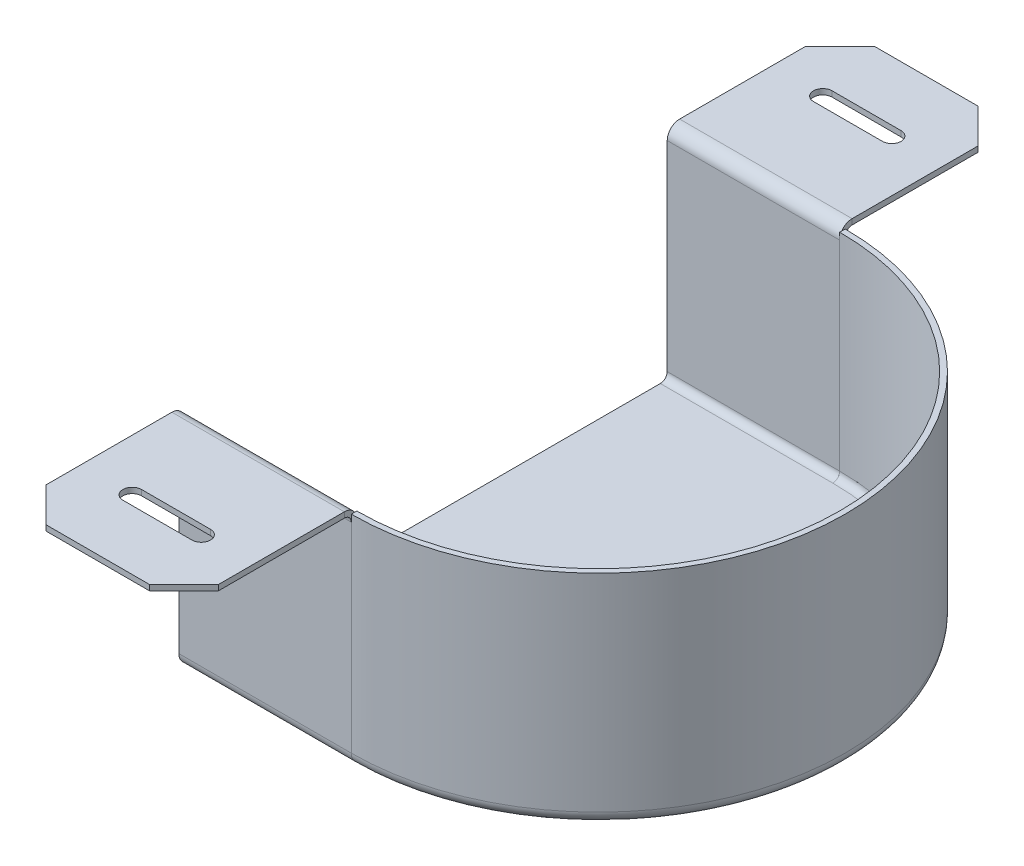
from build123d import *

# Parameters (mm, degrees)
SM_BASE_FLANGE_2_DEPTH             = 1.6
SM_START                           = -50
SM_EDGE_FLANGE_2_DEPTH             = 121.6
SM_EDGE_FLANGE_2_2_DEPTH           = 50
SM_EDGE_FLANGE_2_3_ANGLE           = 180
SM_EDGE_FLANGE_2_4_ANGLE           = 180
SM_EDGE_FLANGE_3_STRIP_W           = 10.4
SM_EDGE_FLANGE_3_STRIP_H           = 1.6
SM_EDGE_FLANGE_3_STRIP_CUT_DEPTH   = 50
SM_EDGE_FLANGE_3_STRIP_2_W         = 10.4
SM_EDGE_FLANGE_3_STRIP_2_H         = 1.6
SM_EDGE_FLANGE_3_STRIP_CUT_2_DEPTH = 50
SM_EDGE_FLANGE_3_DEPTH             = 50
SM_EDGE_FLANGE_3_BEND_DEPTH        = 50
CHAMFER_1_SIZE                     = 10
CUT_EXTRUDE_1_REACH                = 155.608


with BuildPart() as part:
    # 基材-凸緣2: sheet metal written as solids
    # 草圖6 → 基材-凸緣2 (new body)
    with BuildSketch(Plane(origin=(0, 0, 0), x_dir=(1, 0, 0), z_dir=(0, 1, 0))):
        with BuildLine():
            Line((-50, 70), (0, 70))
            ThreePointArc((0, 70), (70, 0), (0, -70))
            Line((0, -70), (-50, -70))
            Line((-50, -70), (-50, 70))
        make_face()
    extrude(amount=SM_BASE_FLANGE_2_DEPTH)

    # 邊線-凸緣2: read off the stored shape, not the designer's step
    # 邊線-凸緣2 outline → 邊線-凸緣2 (cut)
    with BuildSketch(Plane.YZ.offset(SM_START)):
        with BuildLine():
            ThreePointArc((0, 68), (0.155005568, 69.044994432), (0.606674091, 70))
            Line((0.606674091, 70), (0, 70))
            Line((0, 70), (0, 68))
        make_face()
        with BuildLine():
            Line((0, -70), (0.606674091, -70))
            ThreePointArc((0.606674091, -70), (0.155005568, -69.044994432), (0, -68))
            Line((0, -68), (0, -70))
        make_face()
    extrude(amount=SM_EDGE_FLANGE_2_DEPTH, mode=Mode.SUBTRACT)

    # Sm Edge Flange 2 2 outline → Sm Edge Flange 2 2 (add)
    with BuildSketch(Plane.YZ.offset(SM_START)):
        with BuildLine():
            Line((3.6, 70), (63.6, 70))
            Line((63.6, 70), (63.6, 71.6))
            Line((63.6, 71.6), (3.6, 71.6))
            ThreePointArc((3.6, 71.6), (1.902943725, 71.174901573), (0.606674091, 70))
            Line((0.606674091, 70), (1.6, 70))
            Line((1.6, 70), (1.6, 68))
            ThreePointArc((1.6, 68), (2.185786438, 69.414213562), (3.6, 70))
        make_face()
        with BuildLine():
            Line((63.6, -71.6), (63.6, -70))
            Line((63.6, -70), (3.6, -70))
            ThreePointArc((3.6, -70), (2.185786438, -69.414213562), (1.6, -68))
            Line((1.6, -68), (1.6, -70))
            Line((1.6, -70), (0.606674091, -70))
            ThreePointArc((0.606674091, -70), (1.902943725, -71.174901573), (3.6, -71.6))
            Line((3.6, -71.6), (63.6, -71.6))
        make_face()
    extrude(amount=SM_EDGE_FLANGE_2_2_DEPTH)

    # Sm Edge Flange 2 3 outline → Sm Edge Flange 2 3 (revolve, cut)
    with BuildSketch(Plane.ZY):
        with BuildLine():
            ThreePointArc((70, 0.606674091), (69.044994432, 0.155005568), (68, 0))
            Line((68, 0), (70, 0))
            Line((70, 0), (70, 0.606674091))
        make_face()
    revolve(axis=Axis((0, 0, 0), (0, 1, 0)), revolution_arc=SM_EDGE_FLANGE_2_3_ANGLE, mode=Mode.SUBTRACT)

    # Sm Edge Flange 2 4 outline → Sm Edge Flange 2 4 (revolve)
    with BuildSketch(Plane.ZY):
        with BuildLine():
            Line((71.6, 63.6), (70, 63.6))
            Line((70, 63.6), (70, 3.6))
            ThreePointArc((70, 3.6), (69.414213562, 2.185786438), (68, 1.6))
            Line((68, 1.6), (70, 1.6))
            Line((70, 1.6), (70, 0.606674091))
            ThreePointArc((70, 0.606674091), (71.174901573, 1.902943725), (71.6, 3.6))
            Line((71.6, 3.6), (71.6, 63.6))
        make_face()
    revolve(axis=Axis((0, 0, 0), (0, 1, 0)), revolution_arc=SM_EDGE_FLANGE_2_4_ANGLE)

    # 邊線-凸緣3: sheet metal written as solids
    # 邊線-凸緣3 strip (on a plane across the edge) → 邊線-凸緣3 strip cut (cut)
    with BuildSketch(Plane(origin=(0, 63.6, 71.6), x_dir=(0, -1, 0), z_dir=(-1, 0, 0))):
        with Locations((-3.2, -0.8)):
            Rectangle(SM_EDGE_FLANGE_3_STRIP_W, SM_EDGE_FLANGE_3_STRIP_H)
    extrude(amount=SM_EDGE_FLANGE_3_STRIP_CUT_DEPTH, mode=Mode.SUBTRACT)

    # 邊線-凸緣3 strip 2 (on a plane across the edge) → 邊線-凸緣3 strip cut 2 (cut)
    with BuildSketch(Plane(origin=(-50, 63.6, -71.6), x_dir=(0, -1, 0), z_dir=(1, 0, 0))):
        with Locations((-3.2, -0.8)):
            Rectangle(SM_EDGE_FLANGE_3_STRIP_2_W, SM_EDGE_FLANGE_3_STRIP_2_H)
    extrude(amount=SM_EDGE_FLANGE_3_STRIP_CUT_2_DEPTH, mode=Mode.SUBTRACT)

    # 邊線-凸緣3 section (on a plane across the edge) → 邊線-凸緣3 (add)
    with BuildSketch(Plane(origin=(0, 63.6, 71.6), x_dir=(0, -1, 0), z_dir=(-1, 0, 0))):
        with BuildLine():
            Line((-1.6, 2), (-1.6, 48.5))
            Line((-1.6, 48.5), (0, 48.5))
            Line((0, 48.5), (0, 2))
            ThreePointArc((0, 2), (0.585786438, 0.585786438), (2, 0))
            Line((2, 0), (2, -1.6))
            ThreePointArc((2, -1.6), (-0.545584412, -0.545584412), (-1.6, 2))
        make_face()
    extrude(amount=SM_EDGE_FLANGE_3_DEPTH)

    # 邊線-凸緣3 section 2 (on a plane across the edge) → 邊線-凸緣3 bend (add)
    with BuildSketch(Plane(origin=(-50, 63.6, -71.6), x_dir=(0, -1, 0), z_dir=(1, 0, 0))):
        with BuildLine():
            Line((-1.6, 2), (-1.6, 48.5))
            Line((-1.6, 48.5), (0, 48.5))
            Line((0, 48.5), (0, 2))
            ThreePointArc((0, 2), (0.585786438, 0.585786438), (2, 0))
            Line((2, 0), (2, -1.6))
            ThreePointArc((2, -1.6), (-0.545584412, -0.545584412), (-1.6, 2))
        make_face()
    extrude(amount=SM_EDGE_FLANGE_3_BEND_DEPTH)

    # 導角1
    chamfer_1_edges = [part.edges().sort_by_distance(p)[0] for p in [
        (0, 64.4, 120.1),
        (-50, 64.4, 120.1),
        (-50, 64.4, -120.1),
        (0, 64.4, -120.1),
    ]]
    chamfer(chamfer_1_edges, length=CHAMFER_1_SIZE)

    # 草圖18 → 除料-伸長1 (cut, up to next)
    with BuildSketch(Plane.XZ.offset(-63.6), mode=Mode.PRIVATE) as cut_extrude_1_sk1:
        with BuildLine():
            Line((-35, 97.4), (-15, 97.4))
            ThreePointArc((-15, 97.4), (-12.3, 100.1), (-15, 102.8))
            Line((-15, 102.8), (-35, 102.8))
            ThreePointArc((-35, 102.8), (-37.7, 100.1), (-35, 97.4))
        make_face()
    cut_extrude_1_tool1 = extrude(cut_extrude_1_sk1.sketch, amount=-CUT_EXTRUDE_1_REACH, mode=Mode.PRIVATE) & part.part
    # 草圖18 → 除料-伸長1 (cut, up to next)
    with BuildSketch(Plane.XZ.offset(-63.6), mode=Mode.PRIVATE) as cut_extrude_1_sk2:
        with BuildLine():
            Line((-35, -102.8), (-15, -102.8))
            ThreePointArc((-15, -102.8), (-12.3, -100.1), (-15, -97.4))
            Line((-15, -97.4), (-35, -97.4))
            ThreePointArc((-35, -97.4), (-37.7, -100.1), (-35, -102.8))
        make_face()
    cut_extrude_1_tool2 = extrude(cut_extrude_1_sk2.sketch, amount=-CUT_EXTRUDE_1_REACH, mode=Mode.PRIVATE) & part.part
    add(cut_extrude_1_tool1.solids().sort_by_distance((-25, 63.6, 100.1))[0], mode=Mode.SUBTRACT)
    add(cut_extrude_1_tool2.solids().sort_by_distance((-25, 63.6, -100.1))[0], mode=Mode.SUBTRACT)


solid = part.part
